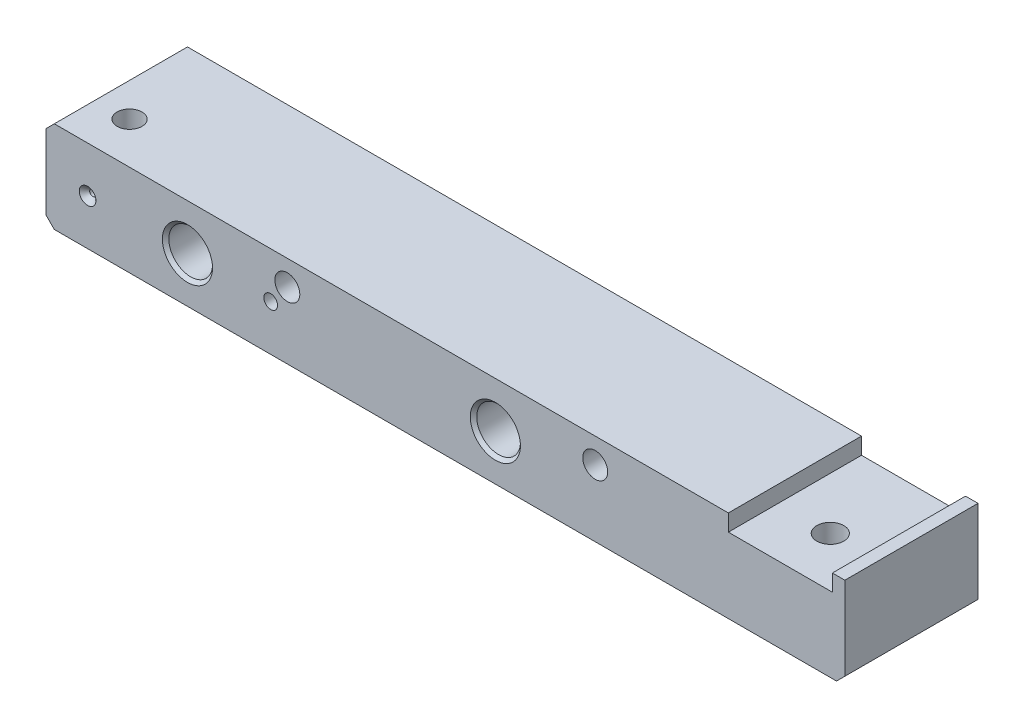
from build123d import *

# Parameters (mm, degrees)
SKETCH1_W                                        = 192
SKETCH1_H                                        = 22
BOSS_EXTRUDE1_DEPTH                              = 16
SKETCH3_W                                        = 25
SKETCH3_H                                        = 4
CUT_EXTRUDE4_DEPTH                               = 32
M12X1_5_TAPPED_HOLE5_D                           = 10.5
M12X1_5_TAPPED_HOLE5_DEPTH                       = 24
M12X1_5_TAPPED_HOLE5_CSINK_D                     = 12.05
M12X1_5_TAPPED_HOLE5_CSINK_ANGLE                 = 90
M12X1_5_TAPPED_HOLE5_TIP                         = 3.15451825
M4X0_7_TAPPED_HOLE1_D                            = 3.3
M4X0_7_TAPPED_HOLE1_DEPTH                        = 11.5
M4X0_7_TAPPED_HOLE1_CSINK_D                      = 4.05
M4X0_7_TAPPED_HOLE1_CSINK_ANGLE                  = 90
M4X0_7_TAPPED_HOLE1_TIP                          = 0.991420021
SKETCH18_R                                       = 3
CUT_EXTRUDE5_DEPTH                               = 102.788997441
CHAMFER1_SIZE                                    = 2
CSK_FOR_M10_FLAT_HEAD_MACHINE_SCREW2_D           = 6.5
CSK_FOR_M10_FLAT_HEAD_MACHINE_SCREW2_CSINK_D     = 13
CSK_FOR_M10_FLAT_HEAD_MACHINE_SCREW2_CSINK_ANGLE = 90
SKETCH24_R                                       = 3
CUT_EXTRUDE6_DEPTH                               = 100.779757466


# Read off the part's stored shape, not the designer's step: CSK for M4 Countersunk Flat Head Screw2, M4 Tapped Hole2
with BuildPart() as part:
    # Sketch1 → Boss-Extrude1 (new, symmetric)
    with BuildSketch(Plane.XY):
        Rectangle(SKETCH1_W, SKETCH1_H)
    extrude(amount=BOSS_EXTRUDE1_DEPTH, both=True)

    # Sketch3 → Cut-Extrude4 (cut)
    with BuildSketch(Plane.XY.offset(16)):
        with Locations((80.5, 9)):
            Rectangle(SKETCH3_W, SKETCH3_H)
    extrude(amount=-CUT_EXTRUDE4_DEPTH, mode=Mode.SUBTRACT)

    # M12x1.5 Tapped Hole5
    with Locations(Plane.XY.offset(16)):
        with Locations((12, 0), (-62, 0)):
            CounterSinkHole(M12X1_5_TAPPED_HOLE5_D / 2, M12X1_5_TAPPED_HOLE5_CSINK_D / 2, depth=M12X1_5_TAPPED_HOLE5_DEPTH, counter_sink_angle=M12X1_5_TAPPED_HOLE5_CSINK_ANGLE)
            with Locations((0, 0, -(M12X1_5_TAPPED_HOLE5_DEPTH + M12X1_5_TAPPED_HOLE5_TIP / 2))):  # 118° drill point
                Cone(0, M12X1_5_TAPPED_HOLE5_D / 2, M12X1_5_TAPPED_HOLE5_TIP, mode=Mode.SUBTRACT)

    # M4x0.7 Tapped Hole1
    with Locations(Plane.XZ.offset(11)):
        with Locations((-61.920151764, 4), (12.028225588, 4)):
            CounterSinkHole(M4X0_7_TAPPED_HOLE1_D / 2, M4X0_7_TAPPED_HOLE1_CSINK_D / 2, depth=M4X0_7_TAPPED_HOLE1_DEPTH, counter_sink_angle=M4X0_7_TAPPED_HOLE1_CSINK_ANGLE)
            with Locations((0, 0, -(M4X0_7_TAPPED_HOLE1_DEPTH + M4X0_7_TAPPED_HOLE1_TIP / 2))):  # 118° drill point
                Cone(0, M4X0_7_TAPPED_HOLE1_D / 2, M4X0_7_TAPPED_HOLE1_TIP, mode=Mode.SUBTRACT)

    # Sketch18 → Cut-Extrude5 (cut, through all)
    with BuildSketch(Plane.XY.offset(16)):
        with Locations((-38, 5)):
            Circle(SKETCH18_R)
        with Locations((36, 5)):
            Circle(SKETCH18_R)
    extrude(amount=-CUT_EXTRUDE5_DEPTH, mode=Mode.SUBTRACT)

    # Chamfer1
    chamfer1_edges = [part.edges().sort_by_distance(p)[0] for p in [
        (96, -11, 0),
        (-96, -11, 0),
        (-96, 11, 0),
    ]]
    chamfer(chamfer1_edges, length=CHAMFER1_SIZE)

    # CSK for M10 Flat Head Machine Screw2 (through all)
    with Locations(Plane.XZ.offset(11)):
        with Locations((80.5, 4)):
            CounterSinkHole(CSK_FOR_M10_FLAT_HEAD_MACHINE_SCREW2_D / 2, CSK_FOR_M10_FLAT_HEAD_MACHINE_SCREW2_CSINK_D / 2, counter_sink_angle=CSK_FOR_M10_FLAT_HEAD_MACHINE_SCREW2_CSINK_ANGLE)

    # Sketch24 → Cut-Extrude6 (cut, through all)
    with BuildSketch(Plane.XZ.offset(11)):
        with Locations(Location((-85.920151764, 6, 0), (0, 0, 270))):
            Circle(SKETCH24_R)
    extrude(amount=-CUT_EXTRUDE6_DEPTH, mode=Mode.SUBTRACT)

    # CSK for M4 Countersunk Flat Head Scr 2 → CSK for M4 Countersunk Flat Head Screw2 (revolve, cut)
    with BuildSketch(Plane(origin=(-86, 0, 0), x_dir=(1, 0, 0), z_dir=(0, -1, 0))):
        Polygon((0, 8.882881782), (0.75, 8.882881782), (0.75, 14.75), (2, 16), (0, 16), align=None)
        Polygon((0.75, -6), (0.75, 3.117108952), (0, 3.117108952), (0, -6.450645464), align=None)
    revolve(axis=Axis((-86, 0, 0), (0, 0, 1)), mode=Mode.SUBTRACT)

    # M4 Tapped Hole2 outline → M4 Tapped Hole2 (revolve, cut)
    with BuildSketch(Plane(origin=(-42, 0, 0), x_dir=(1, 0, 0), z_dir=(0, -1, 0))):
        Polygon((0, 16), (0, -0.991420021), (1.65, 0), (1.65, 16), align=None)
    revolve(axis=Axis((-42, 0, 0), (0, 0, 1)), mode=Mode.SUBTRACT)


solid = part.part
